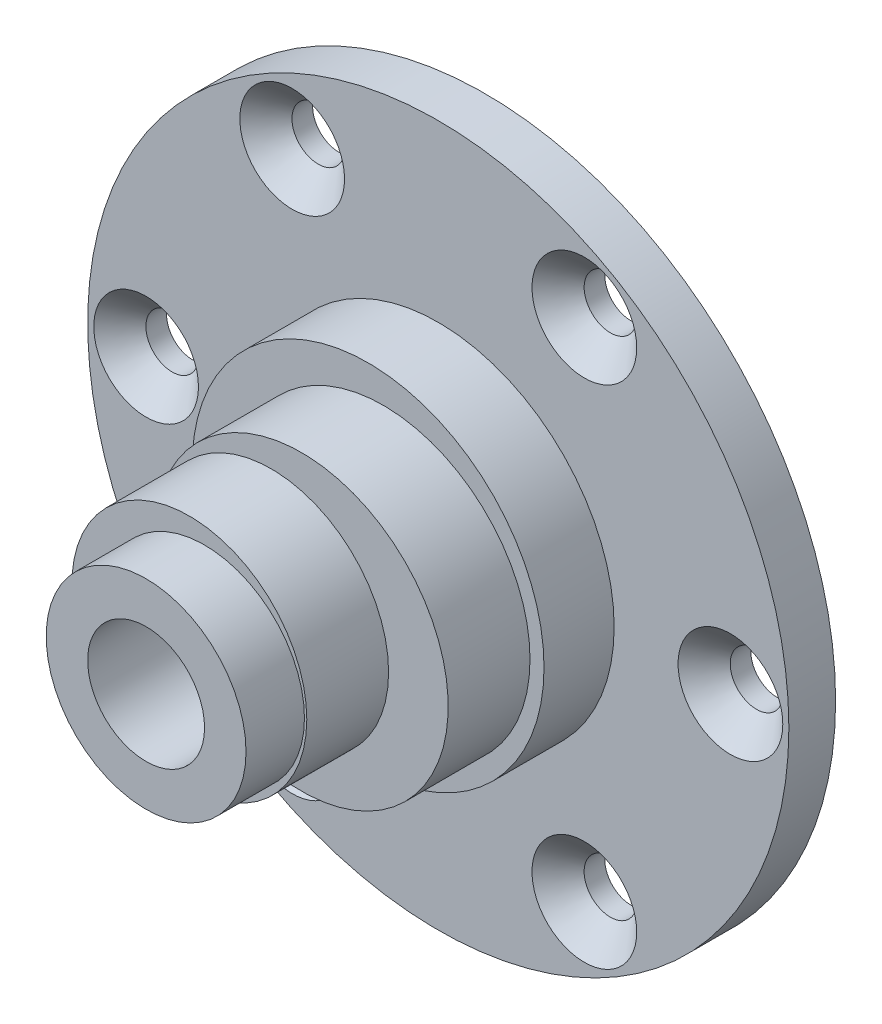
from build123d import *

# Parameters (mm, degrees)
SKETCH1_R                                    = 30
BOSS_EXTRUDE1_DEPTH                          = 4
CSK_FOR_M4_HEX_SOCKET_COUNTERSUNK_CA_2_COUNT = 2
CSK_FOR_M4_HEX_SOCKET_COUNTERSUNK_CA_2_PITCH = 25
CSK_FOR_M4_HEX_SOCKET_COUNTERSUNK_CA_3_COUNT = 2
CSK_FOR_M4_HEX_SOCKET_COUNTERSUNK_CA_3_PITCH = 43.301270189
CSK_FOR_M4_HEX_SOCKET_COUNTERSUNK_CA_4_COUNT = 2
CSK_FOR_M4_HEX_SOCKET_COUNTERSUNK_CA_4_PITCH = 43.301270189
CSK_FOR_M4_HEX_SOCKET_COUNTERSUNK_CA_5_COUNT = 2
CSK_FOR_M4_HEX_SOCKET_COUNTERSUNK_CA_5_PITCH = 50
CSK_FOR_M4_HEX_SOCKET_COUNTERSUNK_CA_6_COUNT = 2
CSK_FOR_M4_HEX_SOCKET_COUNTERSUNK_CA_6_PITCH = 25
SKETCH2_R                                    = 15.05
SKETCH2_R_2                                  = 10.05
BOSS_EXTRUDE3_DEPTH                          = 6
SKETCH5_R                                    = 12
CUT_EXTRUDE2_DEPTH                           = 4
SKETCH6_R                                    = 12.55
BOSS_EXTRUDE4_DEPTH                          = 7
SKETCH7_R                                    = 10.05
BOSS_EXTRUDE5_DEPTH                          = 7
SKETCH8_R                                    = 8.55
BOSS_EXTRUDE6_DEPTH                          = 5
SKETCH9_R                                    = 5
CUT_EXTRUDE3_DEPTH                           = 30


with BuildPart() as part:
    # Sketch1 → Boss-Extrude1 (new body)
    with BuildSketch(Plane.XY):
        Circle(SKETCH1_R)
    extrude(amount=BOSS_EXTRUDE1_DEPTH)

    # Sketch3 → CSK for M4 Hex Socket Countersunk Cap Screw1 (revolve, cut)
    with BuildSketch(Plane(origin=(-12.5, 21.650635095, 4), x_dir=(0, -1, 0), z_dir=(1, 0, 0))):
        Polygon((0, 0), (0, 4), (2.25, 4), (2.25, 2.23), (4.48, 0), align=None)
    csk_for_m4_hex_socket_countersunk_cap_sc = revolve(axis=Axis((-12.5, 21.650635095, 10.35), (0, 0, -1)), mode=Mode.SUBTRACT)

    # CSK for M4 Hex Socket Countersunk Ca 2: CSK for M4 Hex Socket Countersunk Cap Screw1 ×2
    with Locations(*[(i * CSK_FOR_M4_HEX_SOCKET_COUNTERSUNK_CA_2_PITCH, 0, 0) for i in range(1, CSK_FOR_M4_HEX_SOCKET_COUNTERSUNK_CA_2_COUNT)]):
        add(csk_for_m4_hex_socket_countersunk_cap_sc, mode=Mode.SUBTRACT)

    # CSK for M4 Hex Socket Countersunk Ca 3: CSK for M4 Hex Socket Countersunk Cap Screw1 ×2
    with Locations(*[Vector(0.8660254037844606, -0.4999999999999621, 0) * (i * CSK_FOR_M4_HEX_SOCKET_COUNTERSUNK_CA_3_PITCH) for i in range(1, CSK_FOR_M4_HEX_SOCKET_COUNTERSUNK_CA_3_COUNT)]):
        add(csk_for_m4_hex_socket_countersunk_cap_sc, mode=Mode.SUBTRACT)

    # CSK for M4 Hex Socket Countersunk Ca 4: CSK for M4 Hex Socket Countersunk Cap Screw1 ×2
    with Locations(*[(0, -i * CSK_FOR_M4_HEX_SOCKET_COUNTERSUNK_CA_4_PITCH, 0) for i in range(1, CSK_FOR_M4_HEX_SOCKET_COUNTERSUNK_CA_4_COUNT)]):
        add(csk_for_m4_hex_socket_countersunk_cap_sc, mode=Mode.SUBTRACT)

    # CSK for M4 Hex Socket Countersunk Ca 5: CSK for M4 Hex Socket Countersunk Cap Screw1 ×2
    with Locations(*[Vector(0.5000000000000379, -0.8660254037844168, 0) * (i * CSK_FOR_M4_HEX_SOCKET_COUNTERSUNK_CA_5_PITCH) for i in range(1, CSK_FOR_M4_HEX_SOCKET_COUNTERSUNK_CA_5_COUNT)]):
        add(csk_for_m4_hex_socket_countersunk_cap_sc, mode=Mode.SUBTRACT)

    # CSK for M4 Hex Socket Countersunk Ca 6: CSK for M4 Hex Socket Countersunk Cap Screw1 ×2
    with Locations(*[Vector(-0.49999999999996236, -0.8660254037844605, 0) * (i * CSK_FOR_M4_HEX_SOCKET_COUNTERSUNK_CA_6_PITCH) for i in range(1, CSK_FOR_M4_HEX_SOCKET_COUNTERSUNK_CA_6_COUNT)]):
        add(csk_for_m4_hex_socket_countersunk_cap_sc, mode=Mode.SUBTRACT)

    # Sketch2 → Boss-Extrude3 (add)
    with BuildSketch(Plane.XY.offset(4)):
        Circle(SKETCH2_R)
        Circle(SKETCH2_R_2, mode=Mode.SUBTRACT)
    extrude(amount=BOSS_EXTRUDE3_DEPTH)

    # Sketch5 → Cut-Extrude2 (cut)
    with BuildSketch(Plane(origin=(0, 0, 0), x_dir=(-1, 0, 0), z_dir=(0, 0, -1))):
        Circle(SKETCH5_R)
    extrude(amount=-CUT_EXTRUDE2_DEPTH, mode=Mode.SUBTRACT)

    # Sketch6 → Boss-Extrude4 (add)
    with BuildSketch(Plane.XY.offset(10)):
        with Locations((1.3, 0)):
            Circle(SKETCH6_R)
    extrude(amount=BOSS_EXTRUDE4_DEPTH)

    # Sketch7 → Boss-Extrude5 (add)
    with BuildSketch(Plane.XY.offset(17)):
        with Locations((-1.3, 0)):
            Circle(SKETCH7_R)
    extrude(amount=BOSS_EXTRUDE5_DEPTH)

    # Sketch8 → Boss-Extrude6 (add)
    with BuildSketch(Plane.XY.offset(24)):
        Circle(SKETCH8_R)
    extrude(amount=BOSS_EXTRUDE6_DEPTH)

    # Sketch9 → Cut-Extrude3 (cut)
    with BuildSketch(Plane.XY.offset(29)):
        Circle(SKETCH9_R)
    extrude(amount=-CUT_EXTRUDE3_DEPTH, mode=Mode.SUBTRACT)


solid = part.part
